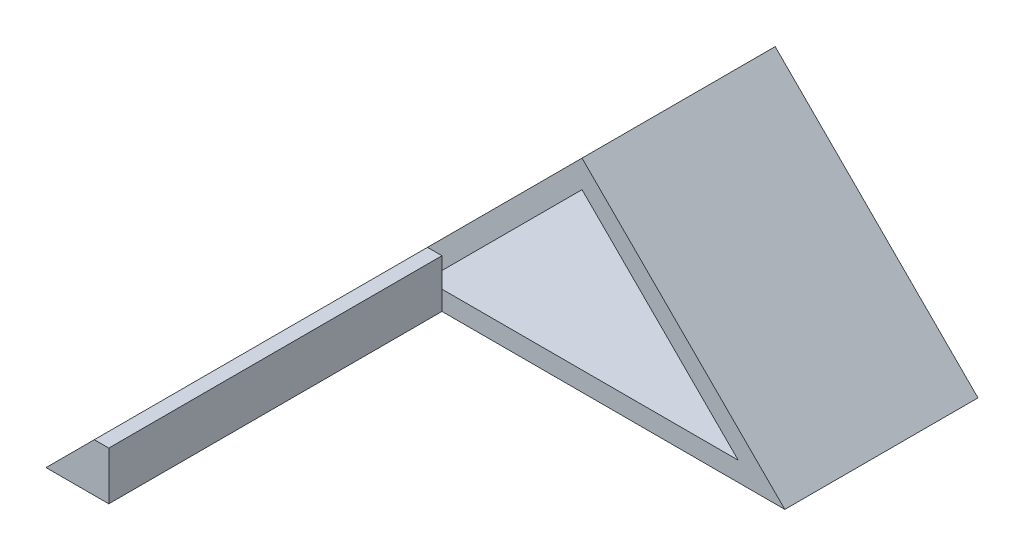
from build123d import *

# Parameters (mm, degrees)
BOSS_EXTRUDE1_DEPTH = 20
BOSS_EXTRUDE4_DEPTH = 69


with BuildPart() as part:
    # Sketch1 → Boss-Extrude1 (new, symmetric)
    with BuildSketch(Plane.XY):
        Polygon((0, 0), (-42, -42), (42, -42), align=None)
        Polygon((-32.343145751, -38), (0, -5.656854249), (32.343145751, -38), align=None, mode=Mode.SUBTRACT)
    extrude(amount=BOSS_EXTRUDE1_DEPTH, both=True)

    # Sketch5 → Boss-Extrude4 (add)
    with BuildSketch(Plane.XY.offset(20)):
        Polygon((-42, -42), (-32, -32), (-29, -32), (-29, -42), align=None)
    extrude(amount=BOSS_EXTRUDE4_DEPTH)


solid = part.part
